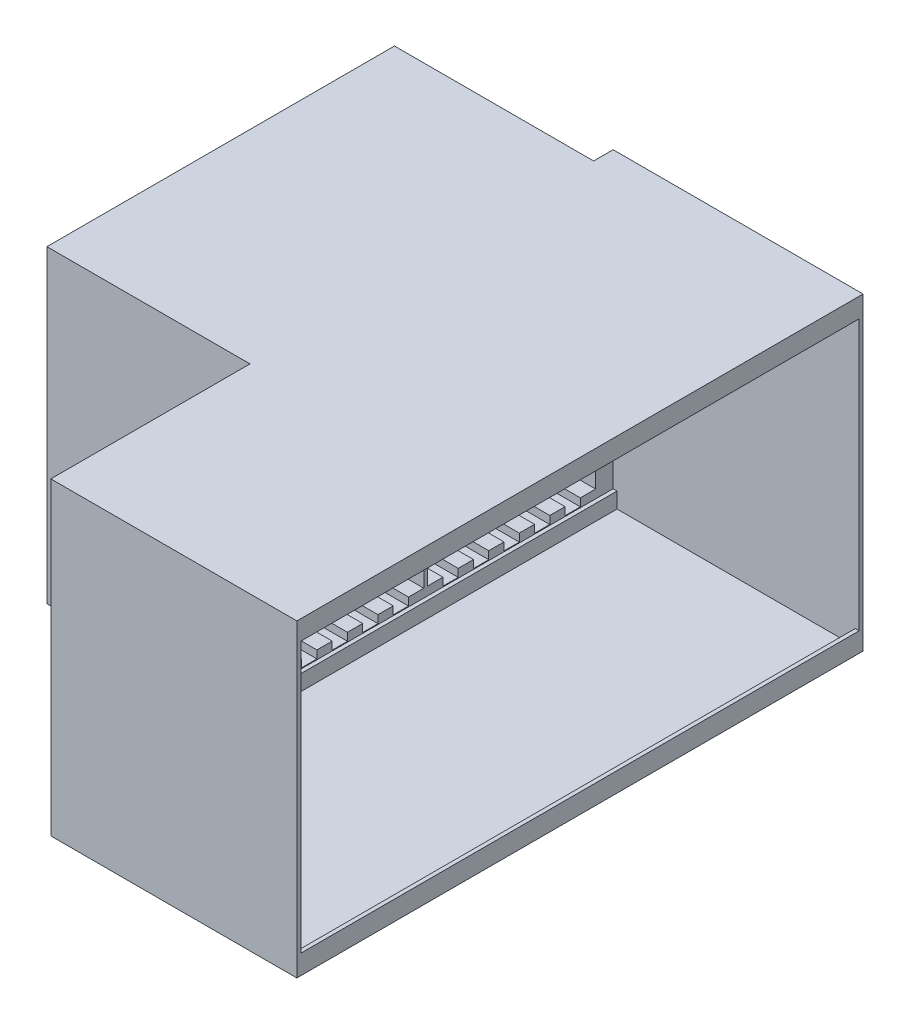
from build123d import *

# Parameters (mm, degrees)
SKETCH_3111_W                        = 940
SKETCH_3111_H                        = 791.96
EXTRUDE_3289_DEPTH                   = 1150
SKETCH_3330_W                        = 930
SKETCH_3330_H                        = 691.96
CUT_EXTRUDE_3389_DEPTH               = 630
SKETCH_3439_W                        = 430
SKETCH_3439_H                        = 320
CUT_EXTRUDE_3531_DEPTH               = 510
SKETCH_3582_W                        = 435
SKETCH_3582_H                        = 320
CUT_EXTRUDE_3675_DEPTH               = 10
SKETCH_3724_W                        = 610
SKETCH_3724_H                        = 930
CUT_EXTRUDE_4252_DEPTH               = 40
SKETCH_4301_W                        = 610
SKETCH_4301_H                        = 930
CUT_EXTRUDE_4432_DEPTH               = 40
SKETCH_4487_W                        = 39.090909091
SKETCH_4487_H                        = 20
CUT_EXTRUDE_4641_DEPTH               = 510
PATTERN_LINEAR_4695_COUNT            = 5
PATTERN_LINEAR_4695_PITCH            = 78.181818182
PATTERN_LINEAR_4763_COUNT            = 2
PATTERN_LINEAR_4763_PITCH            = 440
PATTERN_LINEAR_4763_COUNT_DIR2       = 2
PATTERN_LINEAR_4763_PITCH_DIR2       = 350
PATTERN_LINEAR_4763_COPY_1_SKETCH_W  = 39.090909091
PATTERN_LINEAR_4763_COPY_1_SKETCH_H  = 20
PATTERN_LINEAR_4763_COPY_1_DEPTH     = 510
PATTERN_LINEAR_4763_COPY_2_SKETCH_W  = 39.090909091
PATTERN_LINEAR_4763_COPY_2_SKETCH_H  = 20
PATTERN_LINEAR_4763_COPY_2_DEPTH     = 510
PATTERN_LINEAR_4763_COPY_3_SKETCH_W  = 39.090909091
PATTERN_LINEAR_4763_COPY_3_SKETCH_H  = 20
PATTERN_LINEAR_4763_COPY_3_DEPTH     = 510
PATTERN_LINEAR_4763_COPY_4_SKETCH_W  = 39.090909091
PATTERN_LINEAR_4763_COPY_4_SKETCH_H  = 20
PATTERN_LINEAR_4763_COPY_4_DEPTH     = 510
PATTERN_LINEAR_4763_COPY_5_SKETCH_W  = 39.090909091
PATTERN_LINEAR_4763_COPY_5_SKETCH_H  = 20
PATTERN_LINEAR_4763_COPY_5_DEPTH     = 510
PATTERN_LINEAR_4763_COPY_6_SKETCH_W  = 39.090909091
PATTERN_LINEAR_4763_COPY_6_SKETCH_H  = 20
PATTERN_LINEAR_4763_COPY_6_DEPTH     = 510
PATTERN_LINEAR_4763_COPY_7_SKETCH_W  = 39.090909091
PATTERN_LINEAR_4763_COPY_7_SKETCH_H  = 20
PATTERN_LINEAR_4763_COPY_7_DEPTH     = 510
PATTERN_LINEAR_4763_COPY_8_SKETCH_W  = 39.090909091
PATTERN_LINEAR_4763_COPY_8_SKETCH_H  = 20
PATTERN_LINEAR_4763_COPY_8_DEPTH     = 510
PATTERN_LINEAR_4763_COPY_9_SKETCH_W  = 39.090909091
PATTERN_LINEAR_4763_COPY_9_SKETCH_H  = 20
PATTERN_LINEAR_4763_COPY_9_DEPTH     = 510
PATTERN_LINEAR_4763_COPY_10_SKETCH_W = 39.090909091
PATTERN_LINEAR_4763_COPY_10_SKETCH_H = 20
PATTERN_LINEAR_4763_COPY_10_DEPTH    = 510
PATTERN_LINEAR_4763_COPY_11_SKETCH_W = 39.090909091
PATTERN_LINEAR_4763_COPY_11_SKETCH_H = 20
PATTERN_LINEAR_4763_COPY_11_DEPTH    = 510
PATTERN_LINEAR_4763_COPY_12_SKETCH_W = 39.090909091
PATTERN_LINEAR_4763_COPY_12_SKETCH_H = 20
PATTERN_LINEAR_4763_COPY_12_DEPTH    = 510
PATTERN_LINEAR_4763_COPY_13_SKETCH_W = 39.090909091
PATTERN_LINEAR_4763_COPY_13_SKETCH_H = 20
PATTERN_LINEAR_4763_COPY_13_DEPTH    = 510
PATTERN_LINEAR_4763_COPY_14_SKETCH_W = 39.090909091
PATTERN_LINEAR_4763_COPY_14_SKETCH_H = 20
PATTERN_LINEAR_4763_COPY_14_DEPTH    = 510
PATTERN_LINEAR_4763_COPY_15_SKETCH_W = 39.090909091
PATTERN_LINEAR_4763_COPY_15_SKETCH_H = 20
PATTERN_LINEAR_4763_COPY_15_DEPTH    = 510
EXTRUDE_5423_DEPTH                   = 500
SKETCH_5504_W                        = 630
SKETCH_5504_H                        = 791.96
EXTRUDE_5663_DEPTH                   = 10
SKETCH_14_W                          = 510
SKETCH_14_H                          = 791.96
CUT_EXTRUDE_1_DEPTH                  = 50


with BuildPart() as part:
    # Sketch 3111 → Extrude 3289 (new body)
    with BuildSketch(Plane(origin=(0, 0, 0), x_dir=(0, 0, -1), z_dir=(1, 0, 0))):
        Rectangle(SKETCH_3111_W, SKETCH_3111_H)
    extrude(amount=EXTRUDE_3289_DEPTH)

    # Sketch 3330 → Cut-Extrude 3389 (cut)
    with BuildSketch(Plane(origin=(1150, 0, 0), x_dir=(0, 0, -1), z_dir=(1, 0, 0))):
        with Locations((-5, 0)):
            Rectangle(SKETCH_3330_W, SKETCH_3330_H)
    extrude(amount=-CUT_EXTRUDE_3389_DEPTH, mode=Mode.SUBTRACT)

    # Sketch 3439 → Cut-Extrude 3531 (cut)
    with BuildSketch(Plane(origin=(520, 0, 0), x_dir=(0, 0, -1), z_dir=(1, 0, 0))):
        with Locations((-240, 185.98)):
            Rectangle(SKETCH_3439_W, SKETCH_3439_H)
    cut_extrude_3531 = extrude(amount=-CUT_EXTRUDE_3531_DEPTH, mode=Mode.SUBTRACT)

    # Sketch 3582 → Cut-Extrude 3675 (cut)
    with BuildSketch(Plane.ZY):
        with Locations((242.5, 185.98)):
            Rectangle(SKETCH_3582_W, SKETCH_3582_H)
    cut_extrude_3675 = extrude(amount=-CUT_EXTRUDE_3675_DEPTH, mode=Mode.SUBTRACT)

    # Sketch 3724 → Cut-Extrude 4252 (cut)
    with BuildSketch(Plane(origin=(0, -345.98, 0), x_dir=(1, 0, 0), z_dir=(0, 1, 0))):
        with Locations((835, -5)):
            Rectangle(SKETCH_3724_W, SKETCH_3724_H)
    extrude(amount=-CUT_EXTRUDE_4252_DEPTH, mode=Mode.SUBTRACT)

    # Sketch 4301 → Cut-Extrude 4432 (cut)
    with BuildSketch(Plane.XZ.offset(-345.98)):
        with Locations((835, 5)):
            Rectangle(SKETCH_4301_W, SKETCH_4301_H)
    extrude(amount=-CUT_EXTRUDE_4432_DEPTH, mode=Mode.SUBTRACT)

    # Sketch 4487 → Cut-Extrude 4641 (cut)
    with BuildSketch(Plane(origin=(520, 0, 0), x_dir=(0, 0, -1), z_dir=(1, 0, 0))):
        with Locations((-396.363636364, 15.98)):
            Rectangle(SKETCH_4487_W, SKETCH_4487_H)
    cut_extrude_4641 = extrude(amount=-CUT_EXTRUDE_4641_DEPTH, mode=Mode.SUBTRACT)

    # Pattern Linear 4695: Cut-Extrude 4641 ×5
    with Locations(*[(0, 0, -i * PATTERN_LINEAR_4695_PITCH) for i in range(1, PATTERN_LINEAR_4695_COUNT)]):
        add(cut_extrude_4641, mode=Mode.SUBTRACT)

    # Pattern Linear 4763: Cut-Extrude 3531, Cut-Extrude 3675 2 × 2
    with Locations(*[(0, -j * PATTERN_LINEAR_4763_PITCH_DIR2, -i * PATTERN_LINEAR_4763_PITCH) for i in range(PATTERN_LINEAR_4763_COUNT) for j in range(PATTERN_LINEAR_4763_COUNT_DIR2) if (i, j) != (0, 0)]):
        add(cut_extrude_3531, mode=Mode.SUBTRACT)
        add(cut_extrude_3675, mode=Mode.SUBTRACT)

    # Pattern Linear 4763 copy 1 sketch → Pattern Linear 4763 copy 1 (cut)
    with BuildSketch(Plane(origin=(520, -350, -78.181818182), x_dir=(0, 0, -1), z_dir=(1, 0, 0))):
        with Locations((-396.363636364, 15.98)):
            Rectangle(PATTERN_LINEAR_4763_COPY_1_SKETCH_W, PATTERN_LINEAR_4763_COPY_1_SKETCH_H)
    extrude(amount=-PATTERN_LINEAR_4763_COPY_1_DEPTH, mode=Mode.SUBTRACT)

    # Pattern Linear 4763 copy 2 sketch → Pattern Linear 4763 copy 2 (cut)
    with BuildSketch(Plane(origin=(520, 0, -518.181818182), x_dir=(0, 0, -1), z_dir=(1, 0, 0))):
        with Locations((-396.363636364, 15.98)):
            Rectangle(PATTERN_LINEAR_4763_COPY_2_SKETCH_W, PATTERN_LINEAR_4763_COPY_2_SKETCH_H)
    extrude(amount=-PATTERN_LINEAR_4763_COPY_2_DEPTH, mode=Mode.SUBTRACT)

    # Pattern Linear 4763 copy 3 sketch → Pattern Linear 4763 copy 3 (cut)
    with BuildSketch(Plane(origin=(520, -350, -518.181818182), x_dir=(0, 0, -1), z_dir=(1, 0, 0))):
        with Locations((-396.363636364, 15.98)):
            Rectangle(PATTERN_LINEAR_4763_COPY_3_SKETCH_W, PATTERN_LINEAR_4763_COPY_3_SKETCH_H)
    extrude(amount=-PATTERN_LINEAR_4763_COPY_3_DEPTH, mode=Mode.SUBTRACT)

    # Pattern Linear 4763 copy 4 sketch → Pattern Linear 4763 copy 4 (cut)
    with BuildSketch(Plane(origin=(520, -350, -156.363636364), x_dir=(0, 0, -1), z_dir=(1, 0, 0))):
        with Locations((-396.363636364, 15.98)):
            Rectangle(PATTERN_LINEAR_4763_COPY_4_SKETCH_W, PATTERN_LINEAR_4763_COPY_4_SKETCH_H)
    extrude(amount=-PATTERN_LINEAR_4763_COPY_4_DEPTH, mode=Mode.SUBTRACT)

    # Pattern Linear 4763 copy 5 sketch → Pattern Linear 4763 copy 5 (cut)
    with BuildSketch(Plane(origin=(520, 0, -596.363636364), x_dir=(0, 0, -1), z_dir=(1, 0, 0))):
        with Locations((-396.363636364, 15.98)):
            Rectangle(PATTERN_LINEAR_4763_COPY_5_SKETCH_W, PATTERN_LINEAR_4763_COPY_5_SKETCH_H)
    extrude(amount=-PATTERN_LINEAR_4763_COPY_5_DEPTH, mode=Mode.SUBTRACT)

    # Pattern Linear 4763 copy 6 sketch → Pattern Linear 4763 copy 6 (cut)
    with BuildSketch(Plane(origin=(520, -350, -596.363636364), x_dir=(0, 0, -1), z_dir=(1, 0, 0))):
        with Locations((-396.363636364, 15.98)):
            Rectangle(PATTERN_LINEAR_4763_COPY_6_SKETCH_W, PATTERN_LINEAR_4763_COPY_6_SKETCH_H)
    extrude(amount=-PATTERN_LINEAR_4763_COPY_6_DEPTH, mode=Mode.SUBTRACT)

    # Pattern Linear 4763 copy 7 sketch → Pattern Linear 4763 copy 7 (cut)
    with BuildSketch(Plane(origin=(520, -350, -234.545454545), x_dir=(0, 0, -1), z_dir=(1, 0, 0))):
        with Locations((-396.363636364, 15.98)):
            Rectangle(PATTERN_LINEAR_4763_COPY_7_SKETCH_W, PATTERN_LINEAR_4763_COPY_7_SKETCH_H)
    extrude(amount=-PATTERN_LINEAR_4763_COPY_7_DEPTH, mode=Mode.SUBTRACT)

    # Pattern Linear 4763 copy 8 sketch → Pattern Linear 4763 copy 8 (cut)
    with BuildSketch(Plane(origin=(520, 0, -674.545454545), x_dir=(0, 0, -1), z_dir=(1, 0, 0))):
        with Locations((-396.363636364, 15.98)):
            Rectangle(PATTERN_LINEAR_4763_COPY_8_SKETCH_W, PATTERN_LINEAR_4763_COPY_8_SKETCH_H)
    extrude(amount=-PATTERN_LINEAR_4763_COPY_8_DEPTH, mode=Mode.SUBTRACT)

    # Pattern Linear 4763 copy 9 sketch → Pattern Linear 4763 copy 9 (cut)
    with BuildSketch(Plane(origin=(520, -350, -674.545454545), x_dir=(0, 0, -1), z_dir=(1, 0, 0))):
        with Locations((-396.363636364, 15.98)):
            Rectangle(PATTERN_LINEAR_4763_COPY_9_SKETCH_W, PATTERN_LINEAR_4763_COPY_9_SKETCH_H)
    extrude(amount=-PATTERN_LINEAR_4763_COPY_9_DEPTH, mode=Mode.SUBTRACT)

    # Pattern Linear 4763 copy 10 sketch → Pattern Linear 4763 copy 10 (cut)
    with BuildSketch(Plane(origin=(520, -350, -312.727272727), x_dir=(0, 0, -1), z_dir=(1, 0, 0))):
        with Locations((-396.363636364, 15.98)):
            Rectangle(PATTERN_LINEAR_4763_COPY_10_SKETCH_W, PATTERN_LINEAR_4763_COPY_10_SKETCH_H)
    extrude(amount=-PATTERN_LINEAR_4763_COPY_10_DEPTH, mode=Mode.SUBTRACT)

    # Pattern Linear 4763 copy 11 sketch → Pattern Linear 4763 copy 11 (cut)
    with BuildSketch(Plane(origin=(520, 0, -752.727272727), x_dir=(0, 0, -1), z_dir=(1, 0, 0))):
        with Locations((-396.363636364, 15.98)):
            Rectangle(PATTERN_LINEAR_4763_COPY_11_SKETCH_W, PATTERN_LINEAR_4763_COPY_11_SKETCH_H)
    extrude(amount=-PATTERN_LINEAR_4763_COPY_11_DEPTH, mode=Mode.SUBTRACT)

    # Pattern Linear 4763 copy 12 sketch → Pattern Linear 4763 copy 12 (cut)
    with BuildSketch(Plane(origin=(520, -350, -752.727272727), x_dir=(0, 0, -1), z_dir=(1, 0, 0))):
        with Locations((-396.363636364, 15.98)):
            Rectangle(PATTERN_LINEAR_4763_COPY_12_SKETCH_W, PATTERN_LINEAR_4763_COPY_12_SKETCH_H)
    extrude(amount=-PATTERN_LINEAR_4763_COPY_12_DEPTH, mode=Mode.SUBTRACT)

    # Pattern Linear 4763 copy 13 sketch → Pattern Linear 4763 copy 13 (cut)
    with BuildSketch(Plane(origin=(520, -350, 0), x_dir=(0, 0, -1), z_dir=(1, 0, 0))):
        with Locations((-396.363636364, 15.98)):
            Rectangle(PATTERN_LINEAR_4763_COPY_13_SKETCH_W, PATTERN_LINEAR_4763_COPY_13_SKETCH_H)
    extrude(amount=-PATTERN_LINEAR_4763_COPY_13_DEPTH, mode=Mode.SUBTRACT)

    # Pattern Linear 4763 copy 14 sketch → Pattern Linear 4763 copy 14 (cut)
    with BuildSketch(Plane(origin=(520, 0, -440), x_dir=(0, 0, -1), z_dir=(1, 0, 0))):
        with Locations((-396.363636364, 15.98)):
            Rectangle(PATTERN_LINEAR_4763_COPY_14_SKETCH_W, PATTERN_LINEAR_4763_COPY_14_SKETCH_H)
    extrude(amount=-PATTERN_LINEAR_4763_COPY_14_DEPTH, mode=Mode.SUBTRACT)

    # Pattern Linear 4763 copy 15 sketch → Pattern Linear 4763 copy 15 (cut)
    with BuildSketch(Plane(origin=(520, -350, -440), x_dir=(0, 0, -1), z_dir=(1, 0, 0))):
        with Locations((-396.363636364, 15.98)):
            Rectangle(PATTERN_LINEAR_4763_COPY_15_SKETCH_W, PATTERN_LINEAR_4763_COPY_15_SKETCH_H)
    extrude(amount=-PATTERN_LINEAR_4763_COPY_15_DEPTH, mode=Mode.SUBTRACT)

    # Sketch 4835 → Extrude 5423 (add)
    with BuildSketch(Plane.XY.offset(470)):
        Polygon((1150, -395.98), (1150, -345.98), (1140, -345.98), (1140, -385.98), (530, -385.98), (530, -345.98), (520, -345.98), (520, -395.98), align=None)
        Polygon((1140, 345.98), (1150, 345.98), (1150, 395.98), (520, 395.98), (520, 345.98), (530, 345.98), (530, 385.98), (1140, 385.98), align=None)
    extrude(amount=EXTRUDE_5423_DEPTH)

    # Sketch 5504 → Extrude 5663 (add)
    with BuildSketch(Plane.XY.offset(970)):
        with Locations((835, 0)):
            Rectangle(SKETCH_5504_W, SKETCH_5504_H)
    extrude(amount=EXTRUDE_5663_DEPTH)

    # Эскиз14 → Вырез-Вытянуть1 (cut)
    with BuildSketch(Plane(origin=(0, 0, -470), x_dir=(-1, 0, 0), z_dir=(0, 0, -1))):
        with Locations((-255, 0)):
            Rectangle(SKETCH_14_W, SKETCH_14_H)
    extrude(amount=-CUT_EXTRUDE_1_DEPTH, mode=Mode.SUBTRACT)


solid = part.part
